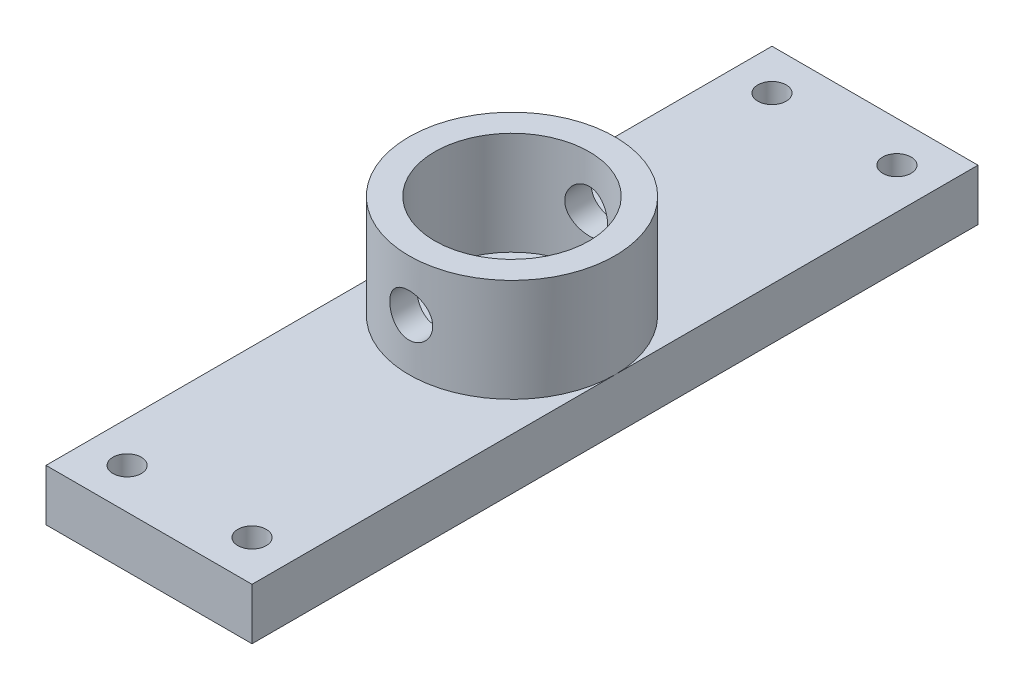
from build123d import *

# Parameters (mm, degrees)
SKETCH1_W           = 25.4
SKETCH1_H           = 89.50000007
SKETCH1_R           = 1.75
BOSS_EXTRUDE1_DEPTH = 6.35
SKETCH2_R           = 12.7
SKETCH2_R_2         = 9.525
BOSS_EXTRUDE2_DEPTH = 12.7
SKETCH4_R           = 2.65
CUT_EXTRUDE2_DEPTH  = 33.02


with BuildPart() as part:
    # Sketch1 → Boss-Extrude1 (new body)
    with BuildSketch(Plane(origin=(0, 0, 0), x_dir=(1, 0, 0), z_dir=(0, 1, 0))):
        with Locations((12.7, 44.750000035)):
            Rectangle(SKETCH1_W, SKETCH1_H)
        with Locations((5, 84.50000007)):
            Circle(SKETCH1_R, mode=Mode.SUBTRACT)
        with Locations((20.4, 84.50000007)):
            Circle(SKETCH1_R, mode=Mode.SUBTRACT)
        with Locations((5, 5)):
            Circle(SKETCH1_R, mode=Mode.SUBTRACT)
        with Locations((20.4, 5)):
            Circle(SKETCH1_R, mode=Mode.SUBTRACT)
    extrude(amount=BOSS_EXTRUDE1_DEPTH)

    # Sketch2 → Boss-Extrude2 (add)
    with BuildSketch(Plane(origin=(0, 6.35, 0), x_dir=(1, 0, 0), z_dir=(0, 1, 0))):
        with Locations((12.7, 44.750000068)):
            Circle(SKETCH2_R)
        with Locations((12.7, 44.750000068)):
            Circle(SKETCH2_R_2, mode=Mode.SUBTRACT)
    extrude(amount=BOSS_EXTRUDE2_DEPTH)

    # Sketch4 → Cut-Extrude2 (cut)
    with BuildSketch(Plane(origin=(0, 0, -32.050000068), x_dir=(0, -1, 0), z_dir=(0, 0, 1))):
        with Locations((-12.7, 12.7)):
            Circle(SKETCH4_R)
    extrude(amount=-CUT_EXTRUDE2_DEPTH, mode=Mode.SUBTRACT)


solid = part.part
